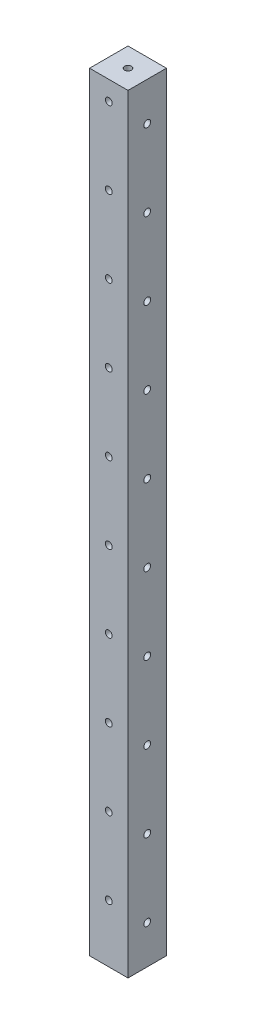
from build123d import *

# Parameters (mm, degrees)
SKETCH1_W                           = 12.7
SKETCH1_H                           = 12.7
BOSS_EXTRUDE1_DEPTH                 = 254
F_4_40_TAPPED_HOLE1_D               = 2.2606
F_4_40_TAPPED_HOLE1_DEPTH           = 7.6
F_4_40_TAPPED_HOLE1_TIP             = 0.679152758
F_4_40_TAPPED_HOLE1_ON_FACE_2_D     = 2.2606
F_4_40_TAPPED_HOLE1_ON_FACE_2_DEPTH = 7.6
F_4_40_TAPPED_HOLE1_ON_FACE_2_TIP   = 0.679152758
F_4_40_TAPPED_HOLE2_D               = 2.2606
LPATTERN1_COUNT                     = 10
LPATTERN1_PITCH                     = 25.4
F_4_40_TAPPED_HOLE3_OUTLINE_R       = 1.1303
F_4_40_TAPPED_HOLE3_DEPTH           = 12.7
LPATTERN2_COUNT                     = 10
LPATTERN2_PITCH                     = 25.4


# Read off the part's stored shape, not the designer's step: #4-40 Tapped Hole3
with BuildPart() as part:
    # Sketch1 → Boss-Extrude1 (new body)
    with BuildSketch(Plane(origin=(0, 0, 0), x_dir=(1, 0, 0), z_dir=(0, 1, 0))):
        with Locations((6.35, -6.35)):
            Rectangle(SKETCH1_W, SKETCH1_H)
    extrude(amount=BOSS_EXTRUDE1_DEPTH)

    # #4-40 Tapped Hole1
    with Locations(Plane(origin=(6.35, 254, 6.35), x_dir=(0, 0, 1), z_dir=(0, 1, 0))):
        with Locations((0, 0)):
            Hole(F_4_40_TAPPED_HOLE1_D / 2, depth=F_4_40_TAPPED_HOLE1_DEPTH)
            with Locations((0, 0, -(F_4_40_TAPPED_HOLE1_DEPTH + F_4_40_TAPPED_HOLE1_TIP / 2))):  # 118° drill point
                Cone(0, F_4_40_TAPPED_HOLE1_D / 2, F_4_40_TAPPED_HOLE1_TIP, mode=Mode.SUBTRACT)

    # #4-40 Tapped Hole1 on face 2
    with Locations(Plane(origin=(6.35, 0, 6.35), x_dir=(0, 0, -1), z_dir=(0, -1, 0))):
        with Locations((0, 0)):
            Hole(F_4_40_TAPPED_HOLE1_ON_FACE_2_D / 2, depth=F_4_40_TAPPED_HOLE1_ON_FACE_2_DEPTH)
            with Locations((0, 0, -(F_4_40_TAPPED_HOLE1_ON_FACE_2_DEPTH + F_4_40_TAPPED_HOLE1_ON_FACE_2_TIP / 2))):  # 118° drill point
                Cone(0, F_4_40_TAPPED_HOLE1_ON_FACE_2_D / 2, F_4_40_TAPPED_HOLE1_ON_FACE_2_TIP, mode=Mode.SUBTRACT)

    # #4-40 Tapped Hole2 (through all)
    with Locations(Plane(origin=(6.35, 247.65, 0), x_dir=(-1, 0, 0), z_dir=(0, 0, -1))):
        with Locations((0, 0)):
            f_4_40_tapped_hole2 = Hole(F_4_40_TAPPED_HOLE2_D / 2)

    # LPattern1: #4-40 Tapped Hole2 ×10
    with Locations(*[(0, -i * LPATTERN1_PITCH, 0) for i in range(1, LPATTERN1_COUNT)]):
        add(f_4_40_tapped_hole2, mode=Mode.SUBTRACT)

    # #4-40 Tapped Hole3 outline → #4-40 Tapped Hole3 (cut)
    with BuildSketch(Plane.YZ):
        with Locations((241.3, 6.35)):
            Circle(F_4_40_TAPPED_HOLE3_OUTLINE_R)
    f_4_40_tapped_hole3 = extrude(amount=F_4_40_TAPPED_HOLE3_DEPTH, mode=Mode.SUBTRACT)

    # LPattern2: #4-40 Tapped Hole3 ×10
    with Locations(*[(0, -i * LPATTERN2_PITCH, 0) for i in range(1, LPATTERN2_COUNT)]):
        add(f_4_40_tapped_hole3, mode=Mode.SUBTRACT)


solid = part.part
